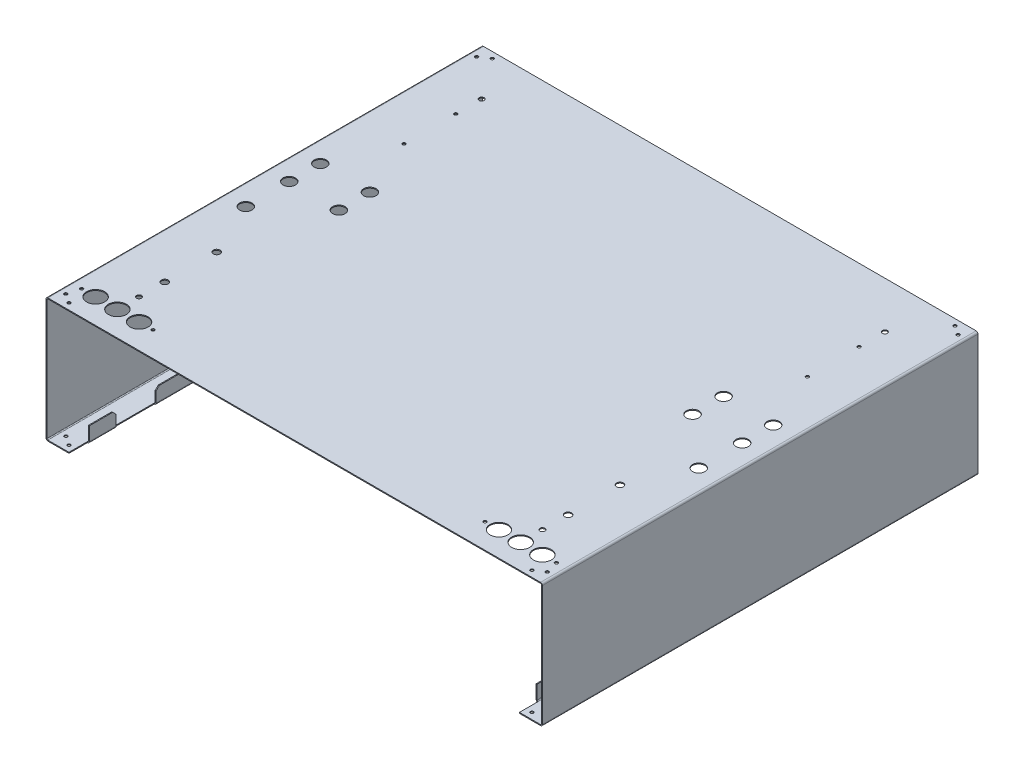
from build123d import *

# Parameters (mm, degrees)
SM_BASE_FLANGE_1_DEPTH = 351
SKETCH_6_W             = 30
SKETCH_6_H             = 25
CUT_EXTRUDE_1_DEPTH    = 3
SKETCH_7_R             = 2.5
CUT_EXTRUDE_1299_DEPTH = 569.507695638
SKETCH_8_R             = 3
CUT_EXTRUDE_1710_DEPTH = 1.5
SKETCH_10_W            = 65
SKETCH_10_H            = 25
CUT_EXTRUDE_4_DEPTH    = 3
OTHER_START            = -361.5
OTHER_1_DEPTH          = 723
SKETCH_11_R            = 10
CUT_EXTRUDE_2693_DEPTH = 10
SKETCH_12_R            = 4
CUT_EXTRUDE_3148_DEPTH = 10
SKETCH_13_R            = 2.5
SKETCH_13_R_2          = 5.5
CUT_EXTRUDE_3688_DEPTH = 10
SKETCH_15_R            = 14.5
SKETCH_15_R_2          = 2.5
CUT_EXTRUDE_4428_DEPTH = 1.5
SKETCH_16_R            = 2.5
CUT_EXTRUDE_5_DEPTH    = 10
SKETCH_17_W            = 100
SKETCH_17_H            = 10
CUT_EXTRUDE_6_DEPTH    = 10


# Read off the part's stored shape, not the designer's step: Затупленный угол1
# Sheet-metal steps are written as plain solids
with BuildPart() as part:
    # Sketch 1 → Базовая кромка1 (new, symmetric)
    with BuildSketch(Plane.XY):
        with BuildLine():
            Line((360, -175), (360, -197))
            ThreePointArc((360, -197), (360.878679656, -199.121320344), (363, -200))
            Line((363, -200), (397, -200))
            ThreePointArc((397, -200), (399.121320344, -199.121320344), (400, -197))
            Line((400, -197), (400, -3))
            ThreePointArc((400, -3), (399.121320344, -0.878679656), (397, 0))
            Line((397, 0), (-397, 0))
            ThreePointArc((-397, 0), (-399.121320344, -0.878679656), (-400, -3))
            Line((-400, -3), (-400, -197))
            ThreePointArc((-400, -197), (-399.121320344, -199.121320344), (-397, -200))
            Line((-397, -200), (-363, -200))
            ThreePointArc((-363, -200), (-360.878679656, -199.121320344), (-360, -197))
            Line((-360, -197), (-360, -175))
            Line((-360, -175), (-361.5, -175))
            Line((-361.5, -175), (-361.5, -197))
            ThreePointArc((-361.5, -197), (-361.939339828, -198.060660172), (-363, -198.5))
            Line((-363, -198.5), (-397, -198.5))
            ThreePointArc((-397, -198.5), (-398.060660172, -198.060660172), (-398.5, -197))
            Line((-398.5, -197), (-398.5, -3))
            ThreePointArc((-398.5, -3), (-398.060660172, -1.939339828), (-397, -1.5))
            Line((-397, -1.5), (397, -1.5))
            ThreePointArc((397, -1.5), (398.060660172, -1.939339828), (398.5, -3))
            Line((398.5, -3), (398.5, -197))
            ThreePointArc((398.5, -197), (398.060660172, -198.060660172), (397, -198.5))
            Line((397, -198.5), (363, -198.5))
            ThreePointArc((363, -198.5), (361.939339828, -198.060660172), (361.5, -197))
            Line((361.5, -197), (361.5, -175))
            Line((361.5, -175), (360, -175))
        make_face()
    extrude(amount=SM_BASE_FLANGE_1_DEPTH, both=True)

    # Эскиз6 → Вырез-Вытянуть1 (cut)
    with BuildSketch(Plane(origin=(-360, 0, 0), x_dir=(0, 0, -1), z_dir=(1, 0, 0))):
        with Locations((-336, -187.5)):
            Rectangle(SKETCH_6_W, SKETCH_6_H)
        with Locations((336, -187.5)):
            Rectangle(SKETCH_6_W, SKETCH_6_H)
    cut_extrude_1 = extrude(amount=-CUT_EXTRUDE_1_DEPTH, mode=Mode.SUBTRACT)

    # Зеркальное отражение1: Вырез-Вытянуть1 across plane
    add(cut_extrude_1.mirror(Plane(origin=(0, 0, 0), x_dir=(0, 0, 1), z_dir=(1, 0, 0))), mode=Mode.SUBTRACT)

    # Эскиз7 → Cut-Extrude 1299 (cut, through all)
    with BuildSketch(Plane.XZ.offset(200)):
        with Locations(Location((-388, 331, 0), (0, 0, 270))):
            Circle(SKETCH_7_R)
        with Locations(Location((-373, 341, 0), (0, 0, 270))):
            Circle(SKETCH_7_R)
        with Locations(Location((-373, -341, 0), (0, 0, 90))):
            Circle(SKETCH_7_R)
        with Locations(Location((-388, -331, 0), (0, 0, 90))):
            Circle(SKETCH_7_R)
        with Locations(Location((388, -331, 0), (0, 0, 270))):
            Circle(SKETCH_7_R)
        with Locations(Location((373, -341, 0), (0, 0, 270))):
            Circle(SKETCH_7_R)
        with Locations(Location((373, 341, 0), (0, 0, 270))):
            Circle(SKETCH_7_R)
        with Locations(Location((388, 331, 0), (0, 0, 270))):
            Circle(SKETCH_7_R)
    extrude(amount=-CUT_EXTRUDE_1299_DEPTH, mode=Mode.SUBTRACT)

    # Эскиз8 → Cut-Extrude 1710 (cut)
    with BuildSketch(Plane.XZ.offset(200)):
        with Locations(Location((371, 256.5, 0), (0, 0, 270))):
            Circle(SKETCH_8_R)
        with Locations(Location((371, 231.5, 0), (0, 0, 270))):
            Circle(SKETCH_8_R)
        with Locations(Location((371, -231.5, 0), (0, 0, 270))):
            Circle(SKETCH_8_R)
        with Locations(Location((371, -256.5, 0), (0, 0, 270))):
            Circle(SKETCH_8_R)
    extrude(amount=-CUT_EXTRUDE_1710_DEPTH, mode=Mode.SUBTRACT)

    # Эскиз10 → Вырез-Вытянуть4 (cut)
    with BuildSketch(Plane.ZY.offset(-360)):
        with Locations((-246, -187.5)):
            Rectangle(SKETCH_10_W, SKETCH_10_H)
        with Locations((246, -187.5)):
            Rectangle(SKETCH_10_W, SKETCH_10_H)
    cut_extrude_4 = extrude(amount=-CUT_EXTRUDE_4_DEPTH, mode=Mode.SUBTRACT)

    # Зеркальное отражение2: Вырез-Вытянуть4 across plane
    add(cut_extrude_4.mirror(Plane(origin=(0, 0, 0), x_dir=(0, 0, 1), z_dir=(1, 0, 0))), mode=Mode.SUBTRACT)

    # Other 1 outline → Other 1 (cut)
    with BuildSketch(Plane.YZ.offset(OTHER_START)):
        Polygon((-180, 213.5), (-175, 208.5), (-175, 213.5), align=None)
        Polygon((-175, -208.5), (-180, -213.5), (-175, -213.5), align=None)
        Polygon((-180, -278.5), (-175, -283.5), (-175, -278.5), align=None)
        Polygon((-175, 283.5), (-180, 278.5), (-175, 278.5), align=None)
    extrude(amount=OTHER_1_DEPTH, mode=Mode.SUBTRACT)

    # Эскиз11 → Cut-Extrude 2693 (cut)
    with BuildSketch(Plane(origin=(0, 0, 0), x_dir=(1, 0, 0), z_dir=(0, 1, 0))):
        with Locations(Location((365, 6, 0), (0, 0, 270))):
            Circle(SKETCH_11_R)
        with Locations(Location((365, 56, 0), (0, 0, 270))):
            Circle(SKETCH_11_R)
        with Locations(Location((285, 56, 0), (0, 0, 270))):
            Circle(SKETCH_11_R)
        with Locations(Location((285, 6, 0), (0, 0, 270))):
            Circle(SKETCH_11_R)
        with Locations(Location((-285, 6, 0), (0, 0, 90))):
            Circle(SKETCH_11_R)
        with Locations(Location((-285, 56, 0), (0, 0, 90))):
            Circle(SKETCH_11_R)
        with Locations(Location((-365, 56, 0), (0, 0, 90))):
            Circle(SKETCH_11_R)
        with Locations(Location((-365, 6, 0), (0, 0, 90))):
            Circle(SKETCH_11_R)
        with Locations(Location((365, -64, 0), (0, 0, 270))):
            Circle(SKETCH_11_R)
        with Locations(Location((-365, -64, 0), (0, 0, 90))):
            Circle(SKETCH_11_R)
    extrude(amount=-CUT_EXTRUDE_2693_DEPTH, mode=Mode.SUBTRACT)

    # Эскиз12 → Cut-Extrude 3148 (cut)
    with BuildSketch(Plane.XZ.offset(1.5)):
        with Locations(Location((325, -276, 0), (0, 0, 270))):
            Circle(SKETCH_12_R)
        with Locations(Location((325, 276, 0), (0, 0, 270))):
            Circle(SKETCH_12_R)
        with Locations(Location((-325, 276, 0), (0, 0, 270))):
            Circle(SKETCH_12_R)
        with Locations(Location((-325, -276, 0), (0, 0, 270))):
            Circle(SKETCH_12_R)
    extrude(amount=-CUT_EXTRUDE_3148_DEPTH, mode=Mode.SUBTRACT)

    # Эскиз13 → Cut-Extrude 3688 (cut)
    with BuildSketch(Plane.XZ.offset(1.5)):
        with Locations(Location((325, -151, 0), (0, 0, 270))):
            Circle(SKETCH_13_R)
        with Locations(Location((-325, -151, 0), (0, 0, 90))):
            Circle(SKETCH_13_R)
        with Locations(Location((325, -234.5, 0), (0, 0, 270))):
            Circle(SKETCH_13_R)
        with Locations(Location((-325, -234.5, 0), (0, 0, 270))):
            Circle(SKETCH_13_R)
        with Locations(Location((-325, 234.5, 0), (0, 0, 90))):
            Circle(SKETCH_13_R_2)
        with Locations(Location((325, 234.5, 0), (0, 0, 90))):
            Circle(SKETCH_13_R_2)
        with Locations(Location((-325, 151, 0), (0, 0, 270))):
            Circle(SKETCH_13_R_2)
        with Locations(Location((325, 151, 0), (0, 0, 90))):
            Circle(SKETCH_13_R_2)
    extrude(amount=-CUT_EXTRUDE_3688_DEPTH, mode=Mode.SUBTRACT)

    # Эскиз15 → Cut-Extrude 4428 (cut)
    with BuildSketch(Plane(origin=(0, 0, 0), x_dir=(1, 0, 0), z_dir=(0, 1, 0))):
        with Locations(Location((-360, -311, 0), (0, 0, 270))):
            Circle(SKETCH_15_R)
        with Locations(Location((-325, -311, 0), (0, 0, 270))):
            Circle(SKETCH_15_R)
        with Locations(Location((325, -311, 0), (0, 0, 90))):
            Circle(SKETCH_15_R)
        with Locations(Location((360, -311, 0), (0, 0, 90))):
            Circle(SKETCH_15_R)
        with Locations(Location((-290, -311, 0), (0, 0, 270))):
            Circle(SKETCH_15_R)
        with Locations(Location((290, -311, 0), (0, 0, 90))):
            Circle(SKETCH_15_R)
        with Locations(Location((-382.5, -311, 0), (0, 0, 270))):
            Circle(SKETCH_15_R_2)
        with Locations(Location((-267.5, -311, 0), (0, 0, 90))):
            Circle(SKETCH_15_R_2)
        with Locations(Location((382.5, -311, 0), (0, 0, 90))):
            Circle(SKETCH_15_R_2)
        with Locations(Location((267.5, -311, 0), (0, 0, 270))):
            Circle(SKETCH_15_R_2)
    extrude(amount=-CUT_EXTRUDE_4428_DEPTH, mode=Mode.SUBTRACT)

    # Эскиз16 → Вырез-Вытянуть5 (cut)
    with BuildSketch(Plane(origin=(-360, 0, 0), x_dir=(0, 0, -1), z_dir=(1, 0, 0))):
        with Locations((288.5, -185)):
            Circle(SKETCH_16_R)
        with Locations((308.5, -185)):
            Circle(SKETCH_16_R)
    cut_extrude_5 = extrude(amount=-CUT_EXTRUDE_5_DEPTH, mode=Mode.SUBTRACT)

    # Зеркальное отражение3: Вырез-Вытянуть5 across plane
    add(cut_extrude_5.mirror(Plane(origin=(0, 0, 0), x_dir=(0, 0, 1), z_dir=(1, 0, 0))), mode=Mode.SUBTRACT)

    # Эскиз17 → Вырез-Вытянуть6 (cut)
    with BuildSketch(Plane(origin=(-360, 0, 0), x_dir=(0, 0, -1), z_dir=(1, 0, 0))):
        with Locations((40, -188)):
            Rectangle(SKETCH_17_W, SKETCH_17_H)
    extrude(amount=-CUT_EXTRUDE_6_DEPTH, mode=Mode.SUBTRACT)


solid = part.part
